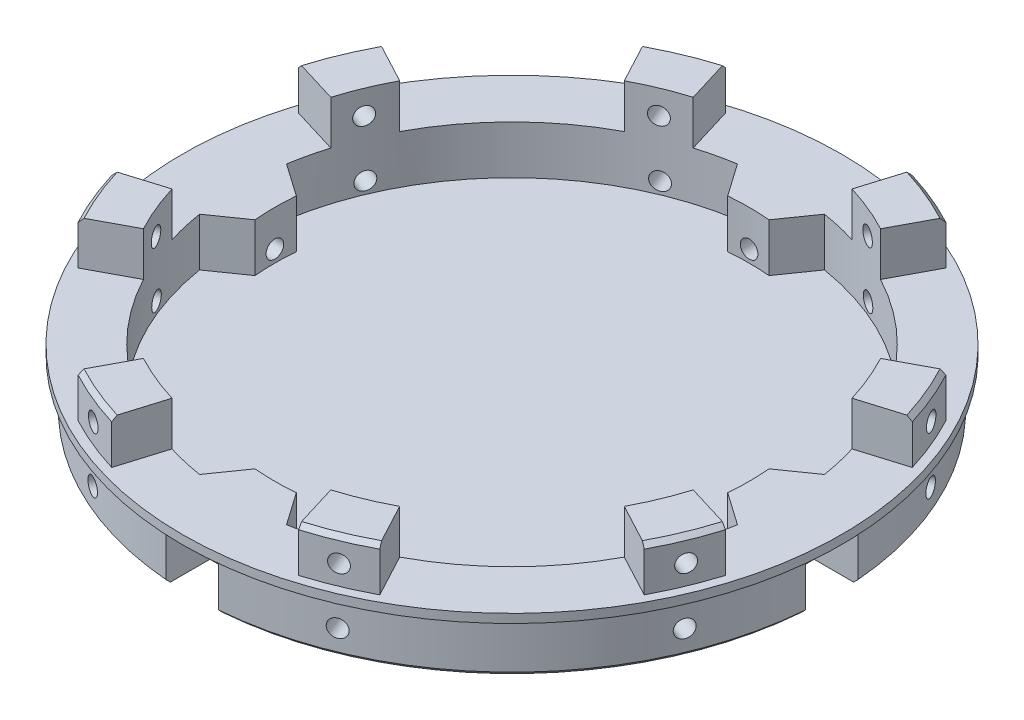
from build123d import *

# Parameters (mm, degrees)
TAGLIO_ESTRUSIONE1_START              = -12
TAGLIO_ESTRUSIONE1_DEPTH              = 12
TAGLIO_ESTRUSIONE3_DEPTH              = 10
SMUSSO1_SIZE                          = 1
SMUSSO2_SIZE                          = 1
RACCORDO1_R                           = 1
SMUSSO3_SIZE                          = 1
RIPETIZIONECIRCOLARE5_COUNT           = 8
SMUSSO3_OF_RIPETIZIONECIRCOLARE5_SIZE = 1
RIPETIZIONECIRCOLARE7_COUNT           = 8
ESTRUSIONE_ESTRUSIONE1_DEPTH          = 11
RIPETIZIONECIRCOLARE8_COUNT           = 4
SCHIZZO12_R                           = 2
TAGLIO_ESTRUSIONE5_DEPTH              = 10
RIPETIZIONECIRCOLARE9_COUNT           = 4
SMUSSO5_SIZE                          = 8
SMUSSO6_SIZE                          = 8


with BuildPart() as part:
    # Schizzo1 → Rivoluzione1 (revolve)
    with BuildSketch(Plane.XY, mode=Mode.PRIVATE) as rivoluzione1_sk:
        Polygon((-73, 24), (-62, 24), (-62, 3), (0, 3), (0, 0), (-73, 0), (-73, 12), (-75, 12), (-75, 14), (-73, 14), align=None)
    revolve(rivoluzione1_sk.sketch.rotate(Axis((0, 0, 0), (0, 1, 0)), 270), axis=Axis((0, 0, 0), (0, 1, 0)))

    # Schizzo2 → Taglio-Estrusione1 (cut)
    with BuildSketch(Plane.XZ.offset(TAGLIO_ESTRUSIONE1_START)):
        with BuildLine():
            Line((-72.753006811, 6), (-62.753006811, 6))
            Line((-62.753006811, 6), (-62.753006811, -6))
            Line((-62.753006811, -6), (-72.753006811, -6))
            ThreePointArc((-72.753006811, -6), (-73, 0), (-72.753006811, 6))
        make_face()
    taglio_estrusione1 = extrude(amount=TAGLIO_ESTRUSIONE1_DEPTH, mode=Mode.SUBTRACT)

    # Schizzo3 → Taglio-Estrusione3 (cut)
    with BuildSketch(Plane(origin=(0, 24, 0), x_dir=(1, 0, 0), z_dir=(0, 1, 0))):
        with BuildLine():
            ThreePointArc((-54.71557638, 29.158287011), (-49.821919988, 36.902253166), (-43.840620434, 43.840620434))
            Line((-43.840620434, 43.840620434), (-51.618795027, 51.618795027))
            ThreePointArc((-51.618795027, 51.618795027), (-58.661292889, 43.449427115), (-64.423178641, 34.331531481))
            Line((-64.423178641, 34.331531481), (-54.71557638, 29.158287011))
        make_face()
        with BuildLine():
            ThreePointArc((-62, 0), (-61.32325093, 9.13558402), (-59.307777568, 18.071732621))
            Line((-59.307777568, 18.071732621), (-69.830125201, 21.278007764))
            ThreePointArc((-69.830125201, 21.278007764), (-72.203182546, 10.756413443), (-73, 0))
            Line((-73, 0), (-62, 0))
        make_face()
    taglio_estrusione3 = extrude(amount=-TAGLIO_ESTRUSIONE3_DEPTH, mode=Mode.SUBTRACT)

    # Schizzo5 → Foro Ø4.0 (4)-1 (revolve, cut)
    with BuildSketch(Plane(origin=(-67.481156182, 18.52127967, -27.844093814), x_dir=(-0.3814259426553719, 0, 0.9243993997561125), z_dir=(0, 1, 0))):
        Polygon((0, 0), (0, 19), (2, 17.798278762), (2, 0), align=None)
    foro_4_0_4_1 = revolve(axis=Axis((-73.351092371, 18.52127967, -30.26614855), (0.9243993997561125, 0, 0.3814259426553719)), mode=Mode.SUBTRACT)

    # Schizzo7 → Foro Ø4.0 (4)-2 (revolve, cut)
    with BuildSketch(Plane(origin=(-62.753006811, 5.770781284, 0), x_dir=(0, 0, 1), z_dir=(0, 1, 0))):
        Polygon((0, 0), (0, 19), (2, 17.798278762), (2, 0), align=None)
    foro_4_0_4_2 = revolve(axis=Axis((-69.103006811, 5.770781284, 0), (1, 0, 0)), mode=Mode.SUBTRACT)

    # Smusso1
    smusso1_edges = [part.edges().sort_by_distance(p)[0] for p in [
        (73, 0, 0),
    ]]
    chamfer(smusso1_edges, length=SMUSSO1_SIZE)

    # Smusso2
    smusso2_edges = [part.edges().sort_by_distance(p)[0] for p in [
        (-62.753006811, 0, 0),
    ]]
    chamfer(smusso2_edges, length=SMUSSO2_SIZE)

    # Raccordo1
    raccordo1_edges = [part.edges().sort_by_distance(p)[0] for p in [
        (-62.753006811, 12, 0),
    ]]
    fillet(raccordo1_edges, radius=RACCORDO1_R)

    # Smusso3
    smusso3_edges = [part.edges().sort_by_distance(p)[0] for p in [
        (-67.443205873, 24, -27.935890563),
    ]]
    chamfer(smusso3_edges, length=SMUSSO3_SIZE)

    # RipetizioneCircolare5: Taglio-Estrusione3, Foro Ø4.0 (4)-1 ×8 about axis
    ripetizionecircolare5_axis = Axis((0, 0, 0), (0, 1, 0))
    add([taglio_estrusione3.rotate(ripetizionecircolare5_axis, i * 360 / RIPETIZIONECIRCOLARE5_COUNT) for i in range(1, RIPETIZIONECIRCOLARE5_COUNT)], mode=Mode.SUBTRACT)
    add([foro_4_0_4_1.rotate(ripetizionecircolare5_axis, i * 360 / RIPETIZIONECIRCOLARE5_COUNT) for i in range(1, RIPETIZIONECIRCOLARE5_COUNT)], mode=Mode.SUBTRACT)

    # Smusso3 of RipetizioneCircolare5
    smusso3_of_ripetizionecircolare5_edges = [part.edges().sort_by_distance(p)[0] for p in [
        (-67.443205873, 24, 27.935890563),
        (-27.935890563, 24, 67.443205873),
        (27.935890563, 24, 67.443205873),
        (67.443205873, 24, 27.935890563),
        (67.443205873, 24, -27.935890563),
        (27.935890563, 24, -67.443205873),
        (-27.935890563, 24, -67.443205873),
    ]]
    chamfer(smusso3_of_ripetizionecircolare5_edges, length=SMUSSO3_OF_RIPETIZIONECIRCOLARE5_SIZE)

    # Schizzo9 → Foro Ø4.0 (4)-3 (revolve, cut)
    with BuildSketch(Plane(origin=(-67.49725461, 5.708772693, 27.805046666), x_dir=(0.38089105022137115, 0, 0.924619926164941), z_dir=(0, 1, 0))):
        Polygon((0, 0), (0, 19), (2, 17.798278762), (2, 0), align=None)
    foro_4_0_4_3 = revolve(axis=Axis((-73.368591141, 5.708772693, 30.223704835), (0.9246199261649409, 0, -0.3808910502213711)), mode=Mode.SUBTRACT)

    # RipetizioneCircolare7: Foro Ø4.0 (4)-3 ×8 about axis
    ripetizionecircolare7_axis = Axis((0, 1, 0), (0, -1, 0))
    for i in range(1, RIPETIZIONECIRCOLARE7_COUNT):
        add(foro_4_0_4_3.rotate(ripetizionecircolare7_axis, i * 360 / RIPETIZIONECIRCOLARE7_COUNT), mode=Mode.SUBTRACT)

    # Schizzo11 → Estrusione-Estrusione1 (add)
    with BuildSketch(Plane(origin=(0, 3, 0), x_dir=(1, 0, 0), z_dir=(0, 1, 0))):
        with BuildLine():
            Line((-5.40365605, 61.764071282), (-4.706410108, 53.794513697))
            ThreePointArc((-4.706410108, 53.794513697), (0, 54), (4.706410108, 53.794513697))
            Line((4.706410108, 53.794513697), (5.40365605, 61.764071282))
            ThreePointArc((5.40365605, 61.764071282), (0, 62), (-5.40365605, 61.764071282))
        make_face()
    estrusione_estrusione1 = extrude(amount=ESTRUSIONE_ESTRUSIONE1_DEPTH)

    # RipetizioneCircolare8: Estrusione-Estrusione1 ×4 about axis
    ripetizionecircolare8_axis = Axis((0, 0, 0), (0, -1, 0))
    for i in range(1, RIPETIZIONECIRCOLARE8_COUNT):
        add(estrusione_estrusione1.rotate(ripetizionecircolare8_axis, i * 360 / RIPETIZIONECIRCOLARE8_COUNT))

    # Schizzo12 → Taglio-Estrusione5 (cut)
    with BuildSketch(Plane.ZY.offset(62.753006811)):
        with Locations((0, 5.770781284)):
            Circle(SCHIZZO12_R)
    extrude(amount=-TAGLIO_ESTRUSIONE5_DEPTH, mode=Mode.SUBTRACT)

    # RipetizioneCircolare9: Taglio-Estrusione1, Foro Ø4.0 (4)-2 ×4 about axis
    ripetizionecircolare9_axis = Axis((0, 0, 0), (0, 1, 0))
    add([taglio_estrusione1.rotate(ripetizionecircolare9_axis, i * 360 / RIPETIZIONECIRCOLARE9_COUNT) for i in range(1, RIPETIZIONECIRCOLARE9_COUNT)], mode=Mode.SUBTRACT)
    add([foro_4_0_4_2.rotate(ripetizionecircolare9_axis, i * 360 / RIPETIZIONECIRCOLARE9_COUNT) for i in range(1, RIPETIZIONECIRCOLARE9_COUNT)], mode=Mode.SUBTRACT)

    # Smusso5
    # the kernel refuses this chamfer: 8, 4.618802154 mm, written as the material it adds along each edge
    with BuildSketch(Plane(origin=(61.764071282, -17.696686037, 5.40365605), x_dir=(-0.9961946980917455, 0, -0.08715574274765815), z_dir=(0, 1, 0))) as smusso5_piece_1_section:
        with BuildLine():
            Line((SMUSSO5_SIZE, 0), (0.165229906, 4.523406623))
            ThreePointArc((0.165229906, 4.523406623), (0.044095582, 2.337928089), (0, 0))
            Line((0, 0), (SMUSSO5_SIZE, 0))
        make_face()
    smusso5_piece_1 = extrude(amount=31.696686037, mode=Mode.PRIVATE)
    smusso5_piece_1 = split(smusso5_piece_1, bisect_by=Plane(origin=(61.764071282, 0, 5.40365605), z_dir=(0, 1, 0)), keep=Keep.TOP, mode=Mode.PRIVATE)
    add(smusso5_piece_1)
    with BuildSketch(Plane(origin=(61.764071282, -17.696686037, -5.40365605), x_dir=(-0.1234621635577297, 0, -0.9923492803290807), z_dir=(0, 1, 0))) as smusso5_piece_2_section:
        with BuildLine():
            Line((4.526423356, 0), (SMUSSO5_SIZE * 0.036503414159, SMUSSO5_SIZE * 0.999333528285))
            Line((SMUSSO5_SIZE * 0.036503414159, SMUSSO5_SIZE * 0.999333528285), (0, 0))
            ThreePointArc((0, 0), (2.337979566, -0.041276164), (4.526423356, 0))
        make_face()
    smusso5_piece_2 = extrude(amount=31.696686037, mode=Mode.PRIVATE)
    smusso5_piece_2 = split(smusso5_piece_2, bisect_by=Plane(origin=(61.764071282, 0, -5.40365605), z_dir=(0, 1, 0)), keep=Keep.TOP, mode=Mode.PRIVATE)
    add(smusso5_piece_2)

    # Smusso6
    # the kernel refuses this chamfer: 8, 4.618802154 mm, written as the material it adds along each edge
    with BuildSketch(Plane(origin=(-5.40365605, 3, -61.764071282), x_dir=(-0.9923492803290808, 0, 0.12346216355772907), z_dir=(0, 1, 0)), Plane(origin=(-61.764071282, 3, 5.40365605), x_dir=(0.1234621635577304, 0, 0.9923492803290805), z_dir=(0, 1, 0))) as smusso6_piece_1:
        with BuildLine():
            Line((4.526423356, 0), (SMUSSO6_SIZE * 0.036503414159, SMUSSO6_SIZE * 0.999333528285))
            Line((SMUSSO6_SIZE * 0.036503414159, SMUSSO6_SIZE * 0.999333528285), (0, 0))
            ThreePointArc((0, 0), (2.337979566, -0.041276164), (4.526423356, 0))
        make_face()
    extrude(amount=11)
    with BuildSketch(Plane(origin=(-61.764071282, 3, -5.40365605), x_dir=(0.12346216355772241, 0, -0.9923492803290815), z_dir=(0, 1, 0)), Plane(origin=(-5.40365605, 3, 61.764071282), x_dir=(-0.9923492803290818, 0, -0.12346216355772176), z_dir=(0, 1, 0))) as smusso6_piece_2:
        with BuildLine():
            Line((4.526423356, 0), (SMUSSO6_SIZE * 0.036503414159, -SMUSSO6_SIZE * 0.999333528285))
            Line((SMUSSO6_SIZE * 0.036503414159, -SMUSSO6_SIZE * 0.999333528285), (0, 0))
            ThreePointArc((0, 0), (2.337979566, 0.041276164), (4.526423356, 0))
        make_face()
    extrude(amount=11)
    with BuildSketch(Plane(origin=(5.40365605, 3, -61.764071282), x_dir=(-0.08715574274765826, 0, 0.9961946980917455), z_dir=(0, 1, 0))) as smusso6_piece_3:
        with BuildLine():
            Line((SMUSSO6_SIZE, 0), (0.165229906, 4.523406623))
            ThreePointArc((0.165229906, 4.523406623), (0.044095582, 2.337928089), (0, 0))
            Line((0, 0), (SMUSSO6_SIZE, 0))
        make_face()
    extrude(amount=11)
    with BuildSketch(Plane(origin=(5.40365605, 3, 61.764071282), x_dir=(-0.0871557427476583, 0, -0.9961946980917455), z_dir=(0, 1, 0))) as smusso6_piece_4:
        with BuildLine():
            Line((SMUSSO6_SIZE, 0), (0.165229906, -4.523406623))
            ThreePointArc((0.165229906, -4.523406623), (0.044095582, -2.337928089), (0, 0))
            Line((0, 0), (SMUSSO6_SIZE, 0))
        make_face()
    extrude(amount=11)


solid = part.part
